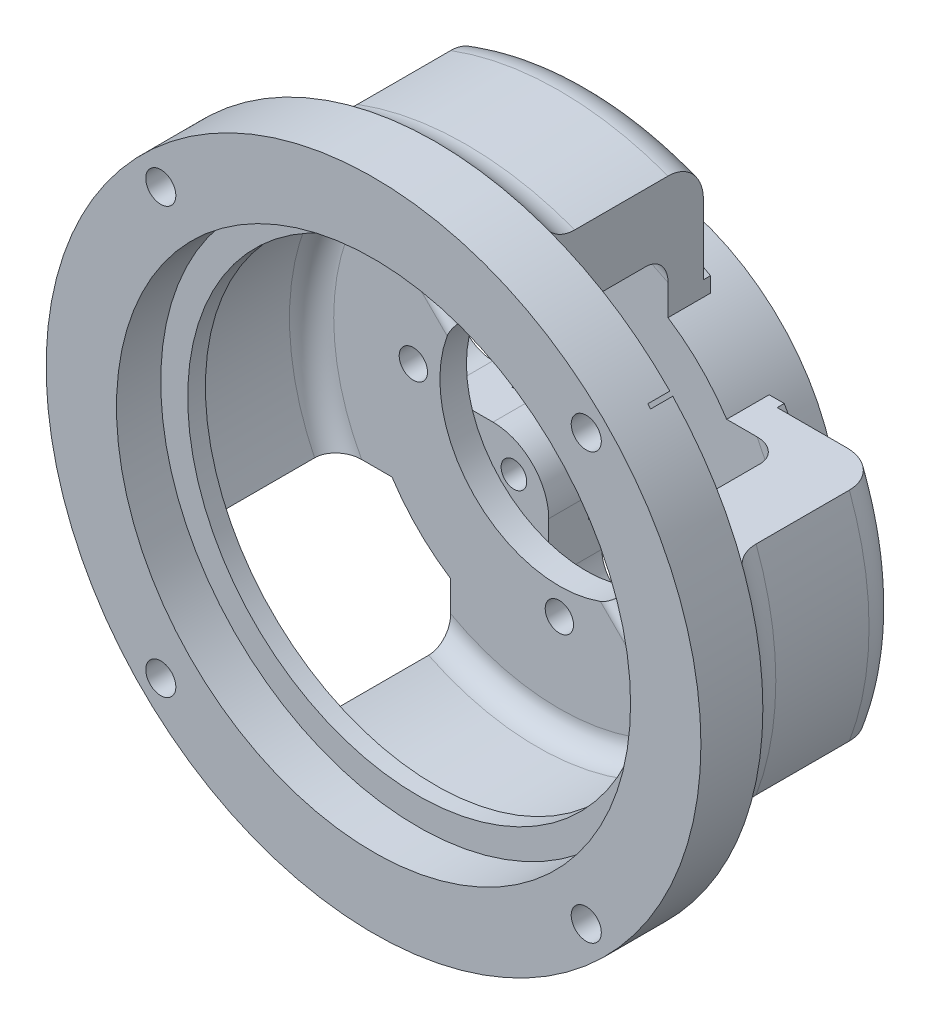
from build123d import *
from build123d.topology import SkipClean

# Parameters (mm, degrees)
SKETCH_1_W                    = 37
SKETCH_1_H                    = 6
CUT_EXTRUDE_1_DEPTH           = 2.5
HOLE_WIZARD_M48_1_D           = 52
HOLE_WIZARD_M48_1_CBORE_D     = 58.1
HOLE_WIZARD_M48_1_CBORE_DEPTH = 4
CUT_EXTRUDE_2_DEPTH           = 53.668776329
CUT_EXTRUDE_2_DEPTH_BACK      = 6
SKETCH_17_R                   = 1.7
SKETCH_18_R                   = 35
EXTRUDE_1_DEPTH               = 23
SKETCH_19_R                   = 28
CUT_EXTRUDE_3_DEPTH           = 14
CUT_EXTRUDE_START             = -23
SKETCH_20_R                   = 13.5
CUT_EXTRUDE_5_DEPTH           = 23
CUT_EXTRUDE_6_DEPTH           = 6
SKETCH_22_R                   = 1.6
CUT_EXTRUDE_7_DEPTH           = 3
SKETCH_24_R                   = 1.45
EXTRUDE_2_DEPTH               = 4.5
CUT_EXTRUDE_START_2           = -5
SKETCH_25_R                   = 35
SKETCH_25_R_2                 = 24
CUT_EXTRUDE_8_DEPTH           = 5
CUT_EXTRUDE_START_3           = -4.2
SKETCH_27_R                   = 24
SKETCH_27_R_2                 = 22.55
CUT_EXTRUDE_9_DEPTH           = 4.2
CUT_EXTRUDE_10_DEPTH          = 1.5
FILLET_1_R                    = 4
FILLET_2_R                    = 2.5
CUT_EXTRUDE_11_DEPTH          = 75.485421665
CUT_EXTRUDE_11_DEPTH_BACK     = 75.485421665
SKETCH_31_W                   = 9.376817256
SKETCH_31_H                   = 2.4
FILLET_3_R                    = 1
FILLET_4_R                    = 4
SKETCH_33_R                   = 37
SKETCH_33_R_2                 = 29.05
SKETCH_33_R_3                 = 1.7
EXTRUDE_3_DEPTH               = 1


with BuildPart() as part:
    # 草图1 → 旋转1 (revolve)
    with BuildSketch(Plane(origin=(0, 0, 0), x_dir=(1, 0, 0), z_dir=(0, 1, 0))):
        with Locations((18.5, 27.010169219)):
            Rectangle(SKETCH_1_W, SKETCH_1_H)
    revolve(axis=Axis((0, 0, -30.010169219), (0, 0, 1)))

    # 草图2 → 切除-拉伸1 (cut)
    with BuildSketch(Plane(origin=(0, 0, -30.010169219), x_dir=(-1, 0, 0), z_dir=(0, 0, -1))):
        Polygon((-22.439483563, -21.26663056), (-25.643777557, -21.26663056), (-27.245924554, -24.04163056), (-25.643777557, -26.81663056), (-22.439483563, -26.81663056), (-20.837336566, -24.04163056), align=None)
        Polygon((-24.04163056, 27.245924554), (-26.81663056, 25.643777557), (-26.81663056, 22.439483563), (-24.04163056, 20.837336566), (-21.26663056, 22.439483563), (-21.26663056, 25.643777557), align=None)
        Polygon((27.245924554, 24.04163056), (25.643777557, 26.81663056), (22.439483563, 26.81663056), (20.837336566, 24.04163056), (22.439483563, 21.26663056), (25.643777557, 21.26663056), align=None)
        Polygon((24.04163056, -27.245924554), (26.81663056, -25.643777557), (26.81663056, -22.439483563), (24.04163056, -20.837336566), (21.26663056, -22.439483563), (21.26663056, -25.643777557), align=None)
    extrude(amount=-CUT_EXTRUDE_1_DEPTH, mode=Mode.SUBTRACT)

    # M48 六角头螺栓的柱形沉头孔1 (through all)
    with Locations(Plane.XY.offset(-24.010169219)):
        with Locations((0, 0)):
            CounterBoreHole(HOLE_WIZARD_M48_1_D / 2, HOLE_WIZARD_M48_1_CBORE_D / 2, HOLE_WIZARD_M48_1_CBORE_DEPTH)

    # 草图17 → 切除-拉伸2 (cut, two sides: drawn at the far end of the back side and taken through both)
    with BuildSketch(Plane(origin=(0, 0, -30.010169219), x_dir=(-1, 0, 0), z_dir=(0, 0, -1)).offset(-CUT_EXTRUDE_2_DEPTH_BACK)):
        with Locations(Location((-24.04163056, -24.04163056, 0), (0, 0, 180))):
            Circle(SKETCH_17_R)
        with Locations(Location((-24.04163056, 24.04163056, 0), (0, 0, 180))):
            Circle(SKETCH_17_R)
        with Locations(Location((24.04163056, 24.04163056, 0), (0, 0, 180))):
            Circle(SKETCH_17_R)
        with Locations(Location((24.04163056, -24.04163056, 0), (0, 0, 180))):
            Circle(SKETCH_17_R)
    extrude(amount=CUT_EXTRUDE_2_DEPTH + CUT_EXTRUDE_2_DEPTH_BACK, mode=Mode.SUBTRACT)

    # 草图18 → 凸台-拉伸1 (add)
    with BuildSketch(Plane(origin=(0, 0, -30.010169219), x_dir=(-1, 0, 0), z_dir=(0, 0, -1))):
        with Locations(Location((0, 0, 0), (0, 0, 140.012926648))):
            Circle(SKETCH_18_R)
    extrude(amount=EXTRUDE_1_DEPTH)

    # 草图19 → 切除-拉伸3 (cut)
    with BuildSketch(Plane.XY.offset(-30.010169219)):
        Circle(SKETCH_19_R)
    extrude(amount=-CUT_EXTRUDE_3_DEPTH, mode=Mode.SUBTRACT)

    # 草图20 → 切除-拉伸5 (cut)
    with BuildSketch(Plane(origin=(0, 0, -53.010169219), x_dir=(-1, 0, 0), z_dir=(0, 0, -1)).offset(CUT_EXTRUDE_START)):
        with BuildLine():
            ThreePointArc((-12.28161024, -18.912021307), (-15.945257916, -15.945257916), (-18.912021307, -12.28161024))
            Line((-18.912021307, -12.28161024), (-32.774411511, -12.28161024))
            ThreePointArc((-32.774411511, -12.28161024), (-24.748737342, -24.748737342), (-12.28161024, -32.774411511))
            Line((-12.28161024, -32.774411511), (-12.28161024, -18.912021307))
        make_face()
        with BuildLine():
            ThreePointArc((-12.28161024, 32.774411511), (-24.748737342, 24.748737342), (-32.774411511, 12.28161024))
            Line((-32.774411511, 12.28161024), (-18.912021307, 12.28161024))
            ThreePointArc((-18.912021307, 12.28161024), (-15.945257916, 15.945257916), (-12.28161024, 18.912021307))
            Line((-12.28161024, 18.912021307), (-12.28161024, 32.774411511))
        make_face()
        with BuildLine():
            Line((12.28161024, -18.912021307), (12.28161024, -32.774411511))
            ThreePointArc((12.28161024, -32.774411511), (24.748737342, -24.748737342), (32.774411511, -12.28161024))
            Line((32.774411511, -12.28161024), (18.912021307, -12.28161024))
            ThreePointArc((18.912021307, -12.28161024), (15.945257916, -15.945257916), (12.28161024, -18.912021307))
        make_face()
        with BuildLine():
            ThreePointArc((32.774411511, 12.28161024), (24.748737342, 24.748737342), (12.28161024, 32.774411511))
            Line((12.28161024, 32.774411511), (12.28161024, 18.912021307))
            ThreePointArc((12.28161024, 18.912021307), (15.945257916, 15.945257916), (18.912021307, 12.28161024))
            Line((18.912021307, 12.28161024), (32.774411511, 12.28161024))
        make_face()
        Circle(SKETCH_20_R)
    extrude(amount=CUT_EXTRUDE_5_DEPTH, mode=Mode.SUBTRACT)

    # 草图21 → 切除-拉伸6 (cut)
    with BuildSketch(Plane(origin=(0, 0, -53.010169219), x_dir=(-1, 0, 0), z_dir=(0, 0, -1))):
        with BuildLine():
            Line((-4.2, 16.5), (-4.2, 10.5))
            ThreePointArc((-4.2, 10.5), (-6.045227279, 6.045227279), (-10.5, 4.2))
            Line((-10.5, 4.2), (-16.5, 4.2))
            ThreePointArc((-16.5, 4.2), (-19.328427125, 3.028427125), (-20.5, 0.2))
            Line((-20.5, 0.2), (-20.5, -0.2))
            ThreePointArc((-20.5, -0.2), (-19.328427125, -3.028427125), (-16.5, -4.2))
            Line((-16.5, -4.2), (-10.5, -4.2))
            ThreePointArc((-10.5, -4.2), (-6.045227279, -6.045227279), (-4.2, -10.5))
            Line((-4.2, -10.5), (-4.2, -16.5))
            ThreePointArc((-4.2, -16.5), (-3.028427125, -19.328427125), (-0.2, -20.5))
            Line((-0.2, -20.5), (0.2, -20.5))
            ThreePointArc((0.2, -20.5), (3.028427125, -19.328427125), (4.2, -16.5))
            Line((4.2, -16.5), (4.2, -10.5))
            ThreePointArc((4.2, -10.5), (6.045227279, -6.045227279), (10.5, -4.2))
            Line((10.5, -4.2), (16.5, -4.2))
            ThreePointArc((16.5, -4.2), (19.328427125, -3.028427125), (20.5, -0.2))
            Line((20.5, -0.2), (20.5, 0.2))
            ThreePointArc((20.5, 0.2), (19.328427125, 3.028427125), (16.5, 4.2))
            Line((16.5, 4.2), (10.5, 4.2))
            ThreePointArc((10.5, 4.2), (6.045227279, 6.045227279), (4.2, 10.5))
            Line((4.2, 10.5), (4.2, 16.5))
            ThreePointArc((4.2, 16.5), (3.028427125, 19.328427125), (0.2, 20.5))
            Line((0.2, 20.5), (-0.2, 20.5))
            ThreePointArc((-0.2, 20.5), (-3.028427125, 19.328427125), (-4.2, 16.5))
        make_face()
    extrude(amount=-CUT_EXTRUDE_6_DEPTH, mode=Mode.SUBTRACT)

    # 草图22 → 切除-拉伸7 (cut)
    with BuildSketch(Plane(origin=(0, 0, -47.010169219), x_dir=(-1, 0, 0), z_dir=(0, 0, -1))):
        with Locations((-16.5, 0)):
            Circle(SKETCH_22_R)
        with Locations((0, 16.5)):
            Circle(SKETCH_22_R)
        with Locations((16.5, 0)):
            Circle(SKETCH_22_R)
        with Locations((0, -16.5)):
            Circle(SKETCH_22_R)
    extrude(amount=-CUT_EXTRUDE_7_DEPTH, mode=Mode.SUBTRACT)

    # 草图24 → 凸台-拉伸2 (add)
    # profile 1 of 4: a face of its own
    with BuildSketch(Plane(origin=(0, 0, -47.010169219), x_dir=(-1, 0, 0), z_dir=(0, 0, -1))):
        with BuildLine():
            Line((-10.5, -4.2), (-12.830042868, -4.2))
            ThreePointArc((-12.830042868, -4.2), (-9.545941546, -9.545941546), (-4.2, -12.830042868))
            Line((-4.2, -12.830042868), (-4.2, -10.5))
            ThreePointArc((-4.2, -10.5), (-6.045227279, -6.045227279), (-10.5, -4.2))
        make_face()
        with Locations((-8.131727984, -8.131727984)):
            Circle(SKETCH_24_R, mode=Mode.SUBTRACT)
    # profile 2 of 4: a face of its own
    with BuildSketch(Plane(origin=(0, 0, -47.010169219), x_dir=(-1, 0, 0), z_dir=(0, 0, -1))):
        with BuildLine():
            ThreePointArc((-4.2, 12.830042868), (-9.545941546, 9.545941546), (-12.830042868, 4.2))
            Line((-12.830042868, 4.2), (-10.5, 4.2))
            ThreePointArc((-10.5, 4.2), (-6.045227279, 6.045227279), (-4.2, 10.5))
            Line((-4.2, 10.5), (-4.2, 12.830042868))
        make_face()
        with Locations((-8.131727984, 8.131727984)):
            Circle(SKETCH_24_R, mode=Mode.SUBTRACT)
    # profile 3 of 4: a face of its own
    with BuildSketch(Plane(origin=(0, 0, -47.010169219), x_dir=(-1, 0, 0), z_dir=(0, 0, -1))):
        with BuildLine():
            Line((4.2, -10.5), (4.2, -12.830042868))
            ThreePointArc((4.2, -12.830042868), (9.545941546, -9.545941546), (12.830042868, -4.2))
            Line((12.830042868, -4.2), (10.5, -4.2))
            ThreePointArc((10.5, -4.2), (6.045227279, -6.045227279), (4.2, -10.5))
        make_face()
        with Locations((8.131727984, -8.131727984)):
            Circle(SKETCH_24_R, mode=Mode.SUBTRACT)
    # profile 4 of 4: a face of its own
    with BuildSketch(Plane(origin=(0, 0, -47.010169219), x_dir=(-1, 0, 0), z_dir=(0, 0, -1))):
        with BuildLine():
            ThreePointArc((12.830042868, 4.2), (9.545941546, 9.545941546), (4.2, 12.830042868))
            Line((4.2, 12.830042868), (4.2, 10.5))
            ThreePointArc((4.2, 10.5), (6.045227279, 6.045227279), (10.5, 4.2))
            Line((10.5, 4.2), (12.830042868, 4.2))
        make_face()
        with Locations((8.131727984, 8.131727984)):
            Circle(SKETCH_24_R, mode=Mode.SUBTRACT)
    extrude(amount=EXTRUDE_2_DEPTH)

    # 草图25 → 切除-拉伸8 (cut)
    with BuildSketch(Plane(origin=(0, 0, -53.010169219), x_dir=(-1, 0, 0), z_dir=(0, 0, -1)).offset(CUT_EXTRUDE_START_2)):
        Circle(SKETCH_25_R)
        Circle(SKETCH_25_R_2, mode=Mode.SUBTRACT)
    extrude(amount=CUT_EXTRUDE_8_DEPTH, mode=Mode.SUBTRACT)

    # 草图27 → 切除-拉伸9 (cut)
    with SkipClean():  # the faces are left unmerged after this step: merging them gives an invalid solid
        with BuildSketch(Plane(origin=(0, 0, -53.010169219), x_dir=(-1, 0, 0), z_dir=(0, 0, -1)).offset(CUT_EXTRUDE_START_3)):
            Circle(SKETCH_27_R)
            Circle(SKETCH_27_R_2, mode=Mode.SUBTRACT)
        extrude(amount=CUT_EXTRUDE_9_DEPTH, mode=Mode.SUBTRACT)

    # 草图29 → 切除-拉伸10 (cut)
    with SkipClean():  # the faces are left unmerged after this step: merging them gives an invalid solid
        with BuildSketch(Plane(origin=(0, 0, -53.010169219), x_dir=(-1, 0, 0), z_dir=(0, 0, -1))):
            with BuildLine():
                Line((-9.5, 11.5), (9.5, 11.5))
                ThreePointArc((9.5, 11.5), (10.914213562, 10.914213562), (11.5, 9.5))
                Line((11.5, 9.5), (11.5, -9.5))
                ThreePointArc((11.5, -9.5), (10.914213562, -10.914213562), (9.5, -11.5))
                Line((9.5, -11.5), (-9.5, -11.5))
                ThreePointArc((-9.5, -11.5), (-10.914213562, -10.914213562), (-11.5, -9.5))
                Line((-11.5, -9.5), (-11.5, 9.5))
                ThreePointArc((-11.5, 9.5), (-10.914213562, 10.914213562), (-9.5, 11.5))
            make_face()
        extrude(amount=-CUT_EXTRUDE_10_DEPTH, mode=Mode.SUBTRACT)

    # 圆角1
    fillet_1_edges = [part.edges().sort_by_distance(p)[0] for p in [
        (35, 0, -48.010169219),
        (0, 35, -48.010169219),
        (-35, 0, -48.010169219),
        (0, -35, -48.010169219),
    ]]
    fillet(fillet_1_edges, radius=FILLET_1_R)

    # 圆角2
    fillet_2_edges = [part.edges().sort_by_distance(p)[0] for p in [
        (0, 28, -44.010169219),
        (-28, 0, -44.010169219),
        (0, -28, -44.010169219),
        (28, 0, -44.010169219),
    ]]
    fillet(fillet_2_edges, radius=FILLET_2_R)

    # 草图31 → 切除-拉伸11 (cut, two sides: drawn at the far end of the back side and taken through both)
    with SkipClean():  # the faces are left unmerged after this step: merging them gives an invalid solid
        with BuildSketch(Plane(origin=(0, 0, 0), x_dir=(-0.7071067811865476, -0.7071067811865476, 0), z_dir=(0.7071067811865476, -0.7071067811865476, 0)).offset(-CUT_EXTRUDE_11_DEPTH_BACK)):
            with Locations((0, 45.210169219)):
                Rectangle(SKETCH_31_W, SKETCH_31_H)
        extrude(amount=CUT_EXTRUDE_11_DEPTH + CUT_EXTRUDE_11_DEPTH_BACK, mode=Mode.SUBTRACT)

    # 圆角3
    fillet_3_edges = [part.edges().sort_by_distance(p)[0] for p in [
        (15.589504736, -8.959093668, -44.010169219),
        (-8.959093668, 15.589504736, -44.010169219),
        (15.589504736, -8.959093668, -46.410169219),
        (-8.959093668, 15.589504736, -46.410169219),
        (-15.589504736, 8.959093668, -46.410169219),
        (8.959093668, -15.589504736, -46.410169219),
        (8.959093668, -15.589504736, -44.010169219),
        (-15.589504736, 8.959093668, -44.010169219),
    ]]
    fillet(fillet_3_edges, radius=FILLET_3_R)

    # 圆角4
    # the kernel refuses this fillet: 4 mm, written as the material it adds along each edge
    with BuildSketch(Plane(origin=(0, 0, -30.010169219), x_dir=(-0.5695776752437953, 0.8219375109239593, 0), z_dir=(-0.8219375109239593, -0.5695776752437953, 0))) as fillet_4_piece_1_section:
        with BuildLine():
            CenterArc((39, 3.464101615), FILLET_4_R, 180, 60)
            Line((35, 3.464101615), (34.92, 3.464101615))
            Line((34.92, 3.464101615), (34.92, 0))
            Line((34.92, 0), (35, -0.08))
            ThreePointArc((35, -0.08), (36, -0.08), (36.96, -0.069282032))
            Line((36.96, -0.069282032), (37, 0))
        make_face()
    fillet_4_piece_1 = revolve(axis=Axis((0, 0, -30.010169219), (0, 0, -1)), revolution_arc=69.441562027, mode=Mode.PRIVATE)
    fillet_4_piece_1 = split(fillet_4_piece_1, bisect_by=Plane(origin=(12.28161024, 35.501724336, -31.454540438), z_dir=(-1, 0, 0)), keep=Keep.TOP, mode=Mode.PRIVATE)
    fillet_4_piece_1 = split(fillet_4_piece_1, bisect_by=Plane(origin=(-12.28161024, 35.501724336, -31.454540438), z_dir=(1, 0, 0)), keep=Keep.TOP, mode=Mode.PRIVATE)
    add(fillet_4_piece_1)
    with BuildSketch(Plane(origin=(0, 0, -30.010169219), x_dir=(0.8219375109239591, 0.5695776752437958, 0), z_dir=(-0.5695776752437958, 0.8219375109239591, 0))) as fillet_4_piece_2_section:
        with BuildLine():
            CenterArc((39, 3.464101615), FILLET_4_R, 180, 60)
            Line((35, 3.464101615), (34.92, 3.464101615))
            Line((34.92, 3.464101615), (34.92, 0))
            Line((34.92, 0), (35, -0.08))
            ThreePointArc((35, -0.08), (36, -0.08), (36.96, -0.069282032))
            Line((36.96, -0.069282032), (37, 0))
        make_face()
    fillet_4_piece_2 = revolve(axis=Axis((0, 0, -30.010169219), (0, 0, -1)), revolution_arc=69.441562027, mode=Mode.PRIVATE)
    fillet_4_piece_2 = split(fillet_4_piece_2, bisect_by=Plane(origin=(35.501724336, -12.28161024, -31.454540438), z_dir=(0, 1, 0)), keep=Keep.TOP, mode=Mode.PRIVATE)
    fillet_4_piece_2 = split(fillet_4_piece_2, bisect_by=Plane(origin=(35.501724336, 12.28161024, -31.454540438), z_dir=(0, -1, 0)), keep=Keep.TOP, mode=Mode.PRIVATE)
    add(fillet_4_piece_2)
    with BuildSketch(Plane(origin=(0, 0, -30.010169219), x_dir=(0.5695776752437955, -0.8219375109239591, 0), z_dir=(0.8219375109239591, 0.5695776752437955, 0))) as fillet_4_piece_3_section:
        with BuildLine():
            CenterArc((39, 3.464101615), FILLET_4_R, 180, 60)
            Line((35, 3.464101615), (34.92, 3.464101615))
            Line((34.92, 3.464101615), (34.92, 0))
            Line((34.92, 0), (35, -0.08))
            ThreePointArc((35, -0.08), (36, -0.08), (36.96, -0.069282032))
            Line((36.96, -0.069282032), (37, 0))
        make_face()
    fillet_4_piece_3 = revolve(axis=Axis((0, 0, -30.010169219), (0, 0, -1)), revolution_arc=69.441562027, mode=Mode.PRIVATE)
    fillet_4_piece_3 = split(fillet_4_piece_3, bisect_by=Plane(origin=(12.28161024, -35.501724336, -31.454540438), z_dir=(-1, 0, 0)), keep=Keep.TOP, mode=Mode.PRIVATE)
    fillet_4_piece_3 = split(fillet_4_piece_3, bisect_by=Plane(origin=(-12.28161024, -35.501724336, -31.454540438), z_dir=(1, 0, 0)), keep=Keep.TOP, mode=Mode.PRIVATE)
    add(fillet_4_piece_3)
    with BuildSketch(Plane(origin=(0, 0, -30.010169219), x_dir=(-0.8219375109239593, -0.5695776752437953, 0), z_dir=(0.5695776752437953, -0.8219375109239593, 0))) as fillet_4_piece_4_section:
        with BuildLine():
            CenterArc((39, 3.464101615), FILLET_4_R, 180, 60)
            Line((35, 3.464101615), (34.92, 3.464101615))
            Line((34.92, 3.464101615), (34.92, 0))
            Line((34.92, 0), (35, -0.08))
            ThreePointArc((35, -0.08), (36, -0.08), (36.96, -0.069282032))
            Line((36.96, -0.069282032), (37, 0))
        make_face()
    fillet_4_piece_4 = revolve(axis=Axis((0, 0, -30.010169219), (0, 0, -1)), revolution_arc=69.441562027, mode=Mode.PRIVATE)
    fillet_4_piece_4 = split(fillet_4_piece_4, bisect_by=Plane(origin=(-35.501724336, 12.28161024, -31.454540438), z_dir=(0, -1, 0)), keep=Keep.TOP, mode=Mode.PRIVATE)
    fillet_4_piece_4 = split(fillet_4_piece_4, bisect_by=Plane(origin=(-35.501724336, -12.28161024, -31.454540438), z_dir=(0, 1, 0)), keep=Keep.TOP, mode=Mode.PRIVATE)
    add(fillet_4_piece_4)

    # 草图33 → 凸台-拉伸3 (add)
    with BuildSketch(Plane.XY.offset(-24.010169219)):
        Circle(SKETCH_33_R)
        Circle(SKETCH_33_R_2, mode=Mode.SUBTRACT)
        with Locations((-24.04163056, -24.04163056)):
            Circle(SKETCH_33_R_3, mode=Mode.SUBTRACT)
        with Locations((24.04163056, -24.04163056)):
            Circle(SKETCH_33_R_3, mode=Mode.SUBTRACT)
        with Locations((24.04163056, 24.04163056)):
            Circle(SKETCH_33_R_3, mode=Mode.SUBTRACT)
        with Locations((-24.04163056, 24.04163056)):
            Circle(SKETCH_33_R_3, mode=Mode.SUBTRACT)
    extrude(amount=EXTRUDE_3_DEPTH)


solid = part.part
